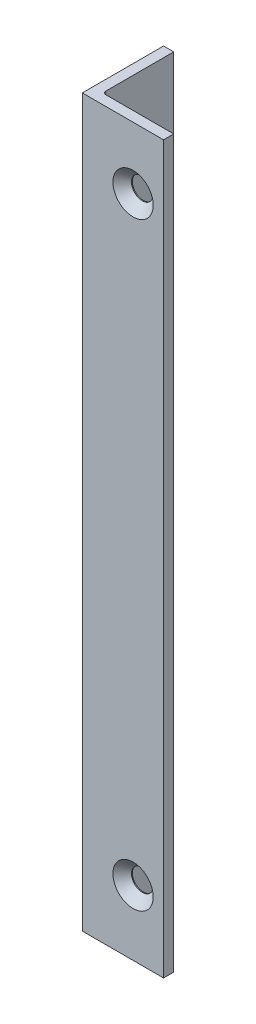
from build123d import *

# Parameters (mm, degrees)
SKETCH1_W                                       = 12.7
SKETCH1_H                                       = 12.7
BOSS_EXTRUDE1_DEPTH                             = 56.75
SKETCH2_W                                       = 11.1125
SKETCH2_H                                       = 11.1125
CUT_EXTRUDE1_DEPTH                              = 114.854710047
FILLET1_R                                       = 0.508
CSK_FOR_M3_FLAT_HEAD_MACHINE_SCREW1_D           = 3.4
CSK_FOR_M3_FLAT_HEAD_MACHINE_SCREW1_CSINK_D     = 6.3
CSK_FOR_M3_FLAT_HEAD_MACHINE_SCREW1_CSINK_ANGLE = 90
CSK_FOR_M3_FLAT_HEAD_MACHINE_SCREW2_D           = 3.4
CSK_FOR_M3_FLAT_HEAD_MACHINE_SCREW2_CSINK_D     = 6.3
CSK_FOR_M3_FLAT_HEAD_MACHINE_SCREW2_CSINK_ANGLE = 90
CSK_FOR_M3_FLAT_HEAD_MACHINE_SCREW3_D           = 3.4
CSK_FOR_M3_FLAT_HEAD_MACHINE_SCREW3_CSINK_D     = 6.3
CSK_FOR_M3_FLAT_HEAD_MACHINE_SCREW3_CSINK_ANGLE = 90
CSK_FOR_M3_FLAT_HEAD_MACHINE_SCREW4_D           = 3.4
CSK_FOR_M3_FLAT_HEAD_MACHINE_SCREW4_CSINK_D     = 6.3
CSK_FOR_M3_FLAT_HEAD_MACHINE_SCREW4_CSINK_ANGLE = 90


with BuildPart() as part:
    # Sketch1 → Boss-Extrude1 (new, symmetric)
    with BuildSketch(Plane(origin=(0, 0, 0), x_dir=(1, 0, 0), z_dir=(0, 1, 0))):
        Rectangle(SKETCH1_W, SKETCH1_H)
    extrude(amount=BOSS_EXTRUDE1_DEPTH, both=True)

    # Sketch2 → Cut-Extrude1 (cut, through all)
    with BuildSketch(Plane(origin=(0, 56.75, 0), x_dir=(1, 0, 0), z_dir=(0, 1, 0))):
        with Locations((0.79375, 0.79375)):
            Rectangle(SKETCH2_W, SKETCH2_H)
    extrude(amount=-CUT_EXTRUDE1_DEPTH, mode=Mode.SUBTRACT)

    # Fillet1
    fillet1_edges = [part.edges().sort_by_distance(p)[0] for p in [
        (-4.7625, 0, 4.7625),
    ]]
    fillet(fillet1_edges, radius=FILLET1_R)

    # CSK for M3 Flat Head Machine Screw1 (through all)
    with Locations(Plane.XY.offset(6.35)):
        with Locations((1.5875, 47.075)):
            CounterSinkHole(CSK_FOR_M3_FLAT_HEAD_MACHINE_SCREW1_D / 2, CSK_FOR_M3_FLAT_HEAD_MACHINE_SCREW1_CSINK_D / 2, counter_sink_angle=CSK_FOR_M3_FLAT_HEAD_MACHINE_SCREW1_CSINK_ANGLE)

    # CSK for M3 Flat Head Machine Screw2 (through all)
    with Locations(Plane.ZY.offset(6.35)):
        with Locations((-1.5875, 47.075)):
            CounterSinkHole(CSK_FOR_M3_FLAT_HEAD_MACHINE_SCREW2_D / 2, CSK_FOR_M3_FLAT_HEAD_MACHINE_SCREW2_CSINK_D / 2, counter_sink_angle=CSK_FOR_M3_FLAT_HEAD_MACHINE_SCREW2_CSINK_ANGLE)

    # CSK for M3 Flat Head Machine Screw3 (through all)
    with Locations(Plane.XY.offset(6.35)):
        with Locations((1.5875, -46.575)):
            CounterSinkHole(CSK_FOR_M3_FLAT_HEAD_MACHINE_SCREW3_D / 2, CSK_FOR_M3_FLAT_HEAD_MACHINE_SCREW3_CSINK_D / 2, counter_sink_angle=CSK_FOR_M3_FLAT_HEAD_MACHINE_SCREW3_CSINK_ANGLE)

    # CSK for M3 Flat Head Machine Screw4 (through all)
    with Locations(Plane.ZY.offset(6.35)):
        with Locations((-1.5875, -46.575)):
            CounterSinkHole(CSK_FOR_M3_FLAT_HEAD_MACHINE_SCREW4_D / 2, CSK_FOR_M3_FLAT_HEAD_MACHINE_SCREW4_CSINK_D / 2, counter_sink_angle=CSK_FOR_M3_FLAT_HEAD_MACHINE_SCREW4_CSINK_ANGLE)


solid = part.part
